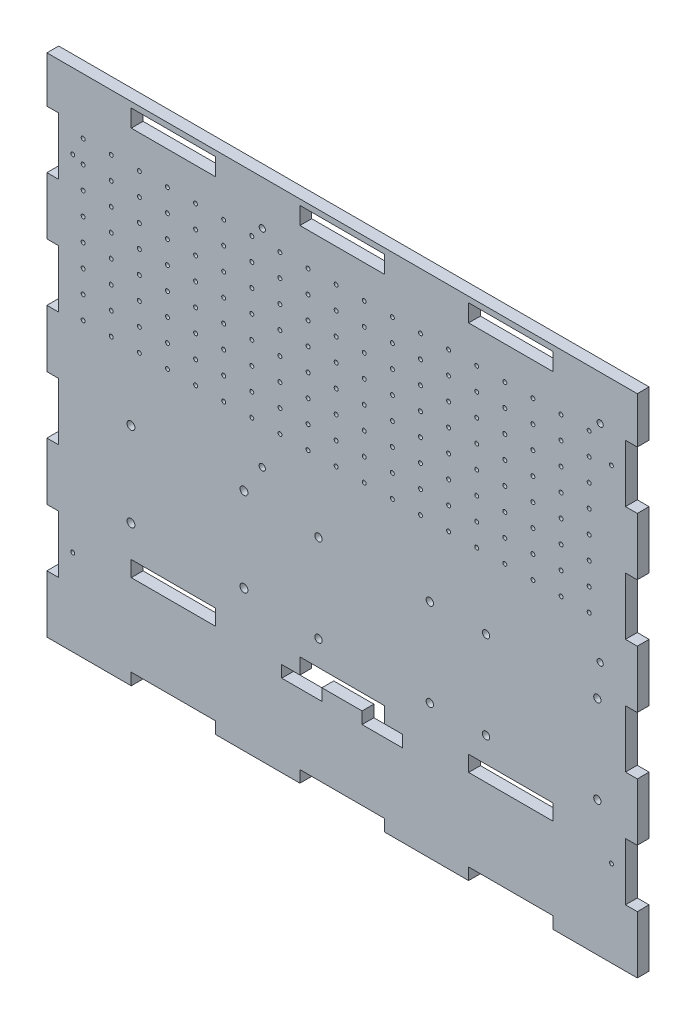
from build123d import *

# Parameters (mm, degrees)
SKETCH1_W                = 266.7
SKETCH1_H                = 223.52
BOSS_EXTRUDE1_DEPTH      = 5.334
SKETCH2_W                = 38.1
SKETCH2_H                = 5.334
CUT_EXTRUDE1_DEPTH       = 197.710659379
SKETCH5_W                = 38.1
SKETCH5_H                = 7.112
CUT_EXTRUDE3_DEPTH       = 197.710659379
SKETCH8_W                = 18.149934459
SKETCH8_H                = 5.334
SKETCH8_W_2              = 18.14993446
CUT_EXTRUDE6_DEPTH       = 197.710659379
SKETCH9_R                = 0.889
CUT_EXTRUDE7_DEPTH       = 197.710659379
SKETCH10_W               = 38.1
SKETCH10_H               = 5.334
BOSS_EXTRUDE2_DEPTH      = 10.16
BOSS_EXTRUDE3_DEPTH      = 76.2
BOSS_EXTRUDE3_DEPTH_BACK = 190.5
SKETCH12_W               = 5.334
SKETCH12_H               = 7.62
SKETCH13_W               = 38.1
SKETCH13_H               = 5.334
BOSS_EXTRUDE4_DEPTH      = 2.54
SKETCH14_W               = 38.1
SKETCH14_H               = 5.334
BOSS_EXTRUDE5_DEPTH      = 2.54
SKETCH15_W               = 38.1
SKETCH15_H               = 5.334
BOSS_EXTRUDE6_DEPTH      = 2.54
SKETCH16_W               = 5.334
SKETCH16_H               = 25.964444445
SKETCH16_H_2             = 25.964444444
CUT_EXTRUDE9_DEPTH       = 205.029793122
SKETCH17_R               = 1.651
CUT_EXTRUDE10_DEPTH      = 205.029793122
SKETCH18_R               = 0.889
CUT_EXTRUDE11_DEPTH      = 205.029793122
SKETCH19_R               = 1.778
CUT_EXTRUDE12_DEPTH      = 205.029793122
SKETCH20_W               = 266.7
SKETCH20_H               = 5.08
CUT_EXTRUDE13_DEPTH      = 205.029793122
SKETCH21_R               = 1.397
CUT_EXTRUDE14_DEPTH      = 201.339246273


with BuildPart() as part:
    # Sketch1 → Boss-Extrude1 (new body)
    with BuildSketch(Plane.XY):
        with Locations((5.474099752, 27.504142138)):
            Rectangle(SKETCH1_W, SKETCH1_H)
    extrude(amount=BOSS_EXTRUDE1_DEPTH)

    # Sketch2 → Cut-Extrude1 (cut, through all)
    with BuildSketch(Plane.XY.offset(5.334)):
        with Locations((-70.725900248, -81.588857862)):
            Rectangle(SKETCH2_W, SKETCH2_H)
        with Locations((5.474099752, -81.588857862)):
            Rectangle(SKETCH2_W, SKETCH2_H)
        with Locations((81.674099752, -81.588857862)):
            Rectangle(SKETCH2_W, SKETCH2_H)
        with Locations((81.674099752, 136.597142138)):
            Rectangle(SKETCH2_W, SKETCH2_H)
        with Locations((5.474099752, 136.597142138)):
            Rectangle(SKETCH2_W, SKETCH2_H)
        with Locations((-70.725900248, 136.597142138)):
            Rectangle(SKETCH2_W, SKETCH2_H)
    extrude(amount=-CUT_EXTRUDE1_DEPTH, mode=Mode.SUBTRACT)

    # Sketch5 → Cut-Extrude3 (cut, through all)
    with BuildSketch(Plane.XY.offset(5.334)):
        with Locations((-70.725900248, -38.378413173)):
            Rectangle(SKETCH5_W, SKETCH5_H)
        with Locations((5.474099752, -38.378413173)):
            Rectangle(SKETCH5_W, SKETCH5_H)
        with Locations((81.674099752, -38.378413173)):
            Rectangle(SKETCH5_W, SKETCH5_H)
    extrude(amount=-CUT_EXTRUDE3_DEPTH, mode=Mode.SUBTRACT)

    # Sketch8 → Cut-Extrude6 (cut, through all)
    with BuildSketch(Plane.XY.offset(5.334)):
        with Locations((-12.722736397, -44.601413173)):
            Rectangle(SKETCH8_W, SKETCH8_H)
        with Locations((23.577132522, -44.601413173)):
            Rectangle(SKETCH8_W_2, SKETCH8_H)
    extrude(amount=-CUT_EXTRUDE6_DEPTH, mode=Mode.SUBTRACT)

    # Sketch9 → Cut-Extrude7 (cut, through all)
    with BuildSketch(Plane.XY.offset(5.334)):
        with Locations((-111.514346632, 118.978930244)):
            Circle(SKETCH9_R)
        with Locations((-98.814346632, 118.978930244)):
            Circle(SKETCH9_R)
        with Locations((-86.114346632, 118.978930244)):
            Circle(SKETCH9_R)
        with Locations((-73.414346632, 118.978930244)):
            Circle(SKETCH9_R)
        with Locations((-60.714346632, 118.978930244)):
            Circle(SKETCH9_R)
        with Locations((-48.014346632, 118.978930244)):
            Circle(SKETCH9_R)
        with Locations((-35.314346632, 118.978930244)):
            Circle(SKETCH9_R)
        with Locations((-22.614346632, 118.978930244)):
            Circle(SKETCH9_R)
        with Locations((-9.914346632, 118.978930244)):
            Circle(SKETCH9_R)
        with Locations((2.785653368, 118.978930244)):
            Circle(SKETCH9_R)
        with Locations((15.485653368, 118.978930244)):
            Circle(SKETCH9_R)
        with Locations((28.185653368, 118.978930244)):
            Circle(SKETCH9_R)
        with Locations((40.885653368, 118.978930244)):
            Circle(SKETCH9_R)
        with Locations((53.585653368, 118.978930244)):
            Circle(SKETCH9_R)
        with Locations((66.285653368, 118.978930244)):
            Circle(SKETCH9_R)
        with Locations((78.985653368, 118.978930244)):
            Circle(SKETCH9_R)
        with Locations((91.685653368, 118.978930244)):
            Circle(SKETCH9_R)
        with Locations((104.385653368, 118.978930244)):
            Circle(SKETCH9_R)
        with Locations((117.085653368, 118.978930244)):
            Circle(SKETCH9_R)
        with Locations((-111.514346632, 108.818930244)):
            Circle(SKETCH9_R)
        with Locations((-98.814346632, 108.818930244)):
            Circle(SKETCH9_R)
        with Locations((-86.114346632, 108.818930244)):
            Circle(SKETCH9_R)
        with Locations((-73.414346632, 108.818930244)):
            Circle(SKETCH9_R)
        with Locations((-60.714346632, 108.818930244)):
            Circle(SKETCH9_R)
        with Locations((-48.014346632, 108.818930244)):
            Circle(SKETCH9_R)
        with Locations((-35.314346632, 108.818930244)):
            Circle(SKETCH9_R)
        with Locations((-22.614346632, 108.818930244)):
            Circle(SKETCH9_R)
        with Locations((-9.914346632, 108.818930244)):
            Circle(SKETCH9_R)
        with Locations((2.785653368, 108.818930244)):
            Circle(SKETCH9_R)
        with Locations((15.485653368, 108.818930244)):
            Circle(SKETCH9_R)
        with Locations((28.185653368, 108.818930244)):
            Circle(SKETCH9_R)
        with Locations((40.885653368, 108.818930244)):
            Circle(SKETCH9_R)
        with Locations((53.585653368, 108.818930244)):
            Circle(SKETCH9_R)
        with Locations((66.285653368, 108.818930244)):
            Circle(SKETCH9_R)
        with Locations((78.985653368, 108.818930244)):
            Circle(SKETCH9_R)
        with Locations((91.685653368, 108.818930244)):
            Circle(SKETCH9_R)
        with Locations((104.385653368, 108.818930244)):
            Circle(SKETCH9_R)
        with Locations((117.085653368, 108.818930244)):
            Circle(SKETCH9_R)
        with Locations((-111.514346632, 98.658930244)):
            Circle(SKETCH9_R)
        with Locations((-98.814346632, 98.658930244)):
            Circle(SKETCH9_R)
        with Locations((-86.114346632, 98.658930244)):
            Circle(SKETCH9_R)
        with Locations((-73.414346632, 98.658930244)):
            Circle(SKETCH9_R)
        with Locations((-60.714346632, 98.658930244)):
            Circle(SKETCH9_R)
        with Locations((-48.014346632, 98.658930244)):
            Circle(SKETCH9_R)
        with Locations((-35.314346632, 98.658930244)):
            Circle(SKETCH9_R)
        with Locations((-22.614346632, 98.658930244)):
            Circle(SKETCH9_R)
        with Locations((-9.914346632, 98.658930244)):
            Circle(SKETCH9_R)
        with Locations((2.785653368, 98.658930244)):
            Circle(SKETCH9_R)
        with Locations((15.485653368, 98.658930244)):
            Circle(SKETCH9_R)
        with Locations((28.185653368, 98.658930244)):
            Circle(SKETCH9_R)
        with Locations((40.885653368, 98.658930244)):
            Circle(SKETCH9_R)
        with Locations((53.585653368, 98.658930244)):
            Circle(SKETCH9_R)
        with Locations((66.285653368, 98.658930244)):
            Circle(SKETCH9_R)
        with Locations((78.985653368, 98.658930244)):
            Circle(SKETCH9_R)
        with Locations((91.685653368, 98.658930244)):
            Circle(SKETCH9_R)
        with Locations((104.385653368, 98.658930244)):
            Circle(SKETCH9_R)
        with Locations((117.085653368, 98.658930244)):
            Circle(SKETCH9_R)
        with Locations((-111.514346632, 88.498930244)):
            Circle(SKETCH9_R)
        with Locations((-98.814346632, 88.498930244)):
            Circle(SKETCH9_R)
        with Locations((-86.114346632, 88.498930244)):
            Circle(SKETCH9_R)
        with Locations((-73.414346632, 88.498930244)):
            Circle(SKETCH9_R)
        with Locations((-60.714346632, 88.498930244)):
            Circle(SKETCH9_R)
        with Locations((-48.014346632, 88.498930244)):
            Circle(SKETCH9_R)
        with Locations((-35.314346632, 88.498930244)):
            Circle(SKETCH9_R)
        with Locations((-22.614346632, 88.498930244)):
            Circle(SKETCH9_R)
        with Locations((-9.914346632, 88.498930244)):
            Circle(SKETCH9_R)
        with Locations((2.785653368, 88.498930244)):
            Circle(SKETCH9_R)
        with Locations((15.485653368, 88.498930244)):
            Circle(SKETCH9_R)
        with Locations((28.185653368, 88.498930244)):
            Circle(SKETCH9_R)
        with Locations((40.885653368, 88.498930244)):
            Circle(SKETCH9_R)
        with Locations((53.585653368, 88.498930244)):
            Circle(SKETCH9_R)
        with Locations((66.285653368, 88.498930244)):
            Circle(SKETCH9_R)
        with Locations((78.985653368, 88.498930244)):
            Circle(SKETCH9_R)
        with Locations((91.685653368, 88.498930244)):
            Circle(SKETCH9_R)
        with Locations((104.385653368, 88.498930244)):
            Circle(SKETCH9_R)
        with Locations((117.085653368, 88.498930244)):
            Circle(SKETCH9_R)
        with Locations((-111.514346632, 78.338930244)):
            Circle(SKETCH9_R)
        with Locations((-98.814346632, 78.338930244)):
            Circle(SKETCH9_R)
        with Locations((-86.114346632, 78.338930244)):
            Circle(SKETCH9_R)
        with Locations((-73.414346632, 78.338930244)):
            Circle(SKETCH9_R)
        with Locations((-60.714346632, 78.338930244)):
            Circle(SKETCH9_R)
        with Locations((-48.014346632, 78.338930244)):
            Circle(SKETCH9_R)
        with Locations((-35.314346632, 78.338930244)):
            Circle(SKETCH9_R)
        with Locations((-22.614346632, 78.338930244)):
            Circle(SKETCH9_R)
        with Locations((-9.914346632, 78.338930244)):
            Circle(SKETCH9_R)
        with Locations((2.785653368, 78.338930244)):
            Circle(SKETCH9_R)
        with Locations((15.485653368, 78.338930244)):
            Circle(SKETCH9_R)
        with Locations((28.185653368, 78.338930244)):
            Circle(SKETCH9_R)
        with Locations((40.885653368, 78.338930244)):
            Circle(SKETCH9_R)
        with Locations((53.585653368, 78.338930244)):
            Circle(SKETCH9_R)
        with Locations((66.285653368, 78.338930244)):
            Circle(SKETCH9_R)
        with Locations((78.985653368, 78.338930244)):
            Circle(SKETCH9_R)
        with Locations((91.685653368, 78.338930244)):
            Circle(SKETCH9_R)
        with Locations((104.385653368, 78.338930244)):
            Circle(SKETCH9_R)
        with Locations((117.085653368, 78.338930244)):
            Circle(SKETCH9_R)
        with Locations((-111.514346632, 68.178930244)):
            Circle(SKETCH9_R)
        with Locations((-98.814346632, 68.178930244)):
            Circle(SKETCH9_R)
        with Locations((-86.114346632, 68.178930244)):
            Circle(SKETCH9_R)
        with Locations((-73.414346632, 68.178930244)):
            Circle(SKETCH9_R)
        with Locations((-60.714346632, 68.178930244)):
            Circle(SKETCH9_R)
        with Locations((-48.014346632, 68.178930244)):
            Circle(SKETCH9_R)
        with Locations((-35.314346632, 68.178930244)):
            Circle(SKETCH9_R)
        with Locations((-22.614346632, 68.178930244)):
            Circle(SKETCH9_R)
        with Locations((-9.914346632, 68.178930244)):
            Circle(SKETCH9_R)
        with Locations((2.785653368, 68.178930244)):
            Circle(SKETCH9_R)
        with Locations((15.485653368, 68.178930244)):
            Circle(SKETCH9_R)
        with Locations((28.185653368, 68.178930244)):
            Circle(SKETCH9_R)
        with Locations((40.885653368, 68.178930244)):
            Circle(SKETCH9_R)
        with Locations((53.585653368, 68.178930244)):
            Circle(SKETCH9_R)
        with Locations((66.285653368, 68.178930244)):
            Circle(SKETCH9_R)
        with Locations((78.985653368, 68.178930244)):
            Circle(SKETCH9_R)
        with Locations((91.685653368, 68.178930244)):
            Circle(SKETCH9_R)
        with Locations((104.385653368, 68.178930244)):
            Circle(SKETCH9_R)
        with Locations((117.085653368, 68.178930244)):
            Circle(SKETCH9_R)
        with Locations((-111.514346632, 58.018930244)):
            Circle(SKETCH9_R)
        with Locations((-98.814346632, 58.018930244)):
            Circle(SKETCH9_R)
        with Locations((-86.114346632, 58.018930244)):
            Circle(SKETCH9_R)
        with Locations((-73.414346632, 58.018930244)):
            Circle(SKETCH9_R)
        with Locations((-60.714346632, 58.018930244)):
            Circle(SKETCH9_R)
        with Locations((-48.014346632, 58.018930244)):
            Circle(SKETCH9_R)
        with Locations((-35.314346632, 58.018930244)):
            Circle(SKETCH9_R)
        with Locations((-22.614346632, 58.018930244)):
            Circle(SKETCH9_R)
        with Locations((-9.914346632, 58.018930244)):
            Circle(SKETCH9_R)
        with Locations((2.785653368, 58.018930244)):
            Circle(SKETCH9_R)
        with Locations((15.485653368, 58.018930244)):
            Circle(SKETCH9_R)
        with Locations((28.185653368, 58.018930244)):
            Circle(SKETCH9_R)
        with Locations((40.885653368, 58.018930244)):
            Circle(SKETCH9_R)
        with Locations((53.585653368, 58.018930244)):
            Circle(SKETCH9_R)
        with Locations((66.285653368, 58.018930244)):
            Circle(SKETCH9_R)
        with Locations((78.985653368, 58.018930244)):
            Circle(SKETCH9_R)
        with Locations((91.685653368, 58.018930244)):
            Circle(SKETCH9_R)
        with Locations((104.385653368, 58.018930244)):
            Circle(SKETCH9_R)
        with Locations((117.085653368, 58.018930244)):
            Circle(SKETCH9_R)
        with Locations((-111.514346632, 47.858930244)):
            Circle(SKETCH9_R)
        with Locations((-98.814346632, 47.858930244)):
            Circle(SKETCH9_R)
        with Locations((-86.114346632, 47.858930244)):
            Circle(SKETCH9_R)
        with Locations((-73.414346632, 47.858930244)):
            Circle(SKETCH9_R)
        with Locations((-60.714346632, 47.858930244)):
            Circle(SKETCH9_R)
        with Locations((-48.014346632, 47.858930244)):
            Circle(SKETCH9_R)
        with Locations((-35.314346632, 47.858930244)):
            Circle(SKETCH9_R)
        with Locations((-22.614346632, 47.858930244)):
            Circle(SKETCH9_R)
        with Locations((-9.914346632, 47.858930244)):
            Circle(SKETCH9_R)
        with Locations((2.785653368, 47.858930244)):
            Circle(SKETCH9_R)
        with Locations((15.485653368, 47.858930244)):
            Circle(SKETCH9_R)
        with Locations((28.185653368, 47.858930244)):
            Circle(SKETCH9_R)
        with Locations((40.885653368, 47.858930244)):
            Circle(SKETCH9_R)
        with Locations((53.585653368, 47.858930244)):
            Circle(SKETCH9_R)
        with Locations((66.285653368, 47.858930244)):
            Circle(SKETCH9_R)
        with Locations((78.985653368, 47.858930244)):
            Circle(SKETCH9_R)
        with Locations((91.685653368, 47.858930244)):
            Circle(SKETCH9_R)
        with Locations((104.385653368, 47.858930244)):
            Circle(SKETCH9_R)
        with Locations((117.085653368, 47.858930244)):
            Circle(SKETCH9_R)
    extrude(amount=-CUT_EXTRUDE7_DEPTH, mode=Mode.SUBTRACT)

    # Sketch10 → Boss-Extrude2 (add)
    with BuildSketch(Plane(origin=(0, 139.264142138, 0), x_dir=(1, 0, 0), z_dir=(0, 1, 0))):
        with Locations((-32.625900248, -2.667)):
            Rectangle(SKETCH10_W, SKETCH10_H)
    extrude(amount=BOSS_EXTRUDE2_DEPTH)

    # Sketch12 → Boss-Extrude3 (add, two sides: drawn at the far end of the back side and taken through both)
    with BuildSketch(Plane.ZY.offset(51.675900248).offset(-BOSS_EXTRUDE3_DEPTH_BACK)):
        with Locations((2.667, 145.614142138)):
            Rectangle(SKETCH12_W, SKETCH12_H)
    extrude(amount=BOSS_EXTRUDE3_DEPTH + BOSS_EXTRUDE3_DEPTH_BACK)

    # Sketch13 → Boss-Extrude4 (add)
    with BuildSketch(Plane(origin=(0, 139.264142138, 0), x_dir=(1, 0, 0), z_dir=(0, 1, 0))):
        with Locations((-108.825900248, -2.667)):
            Rectangle(SKETCH13_W, SKETCH13_H)
    extrude(amount=BOSS_EXTRUDE4_DEPTH)

    # Sketch14 → Boss-Extrude5 (add)
    with BuildSketch(Plane(origin=(0, 139.264142138, 0), x_dir=(1, 0, 0), z_dir=(0, 1, 0))):
        with Locations((43.574099752, -2.667)):
            Rectangle(SKETCH14_W, SKETCH14_H)
    extrude(amount=BOSS_EXTRUDE5_DEPTH)

    # Sketch15 → Boss-Extrude6 (add)
    with BuildSketch(Plane(origin=(0, 139.264142138, 0), x_dir=(1, 0, 0), z_dir=(0, 1, 0))):
        with Locations((119.774099752, -2.667)):
            Rectangle(SKETCH15_W, SKETCH15_H)
    extrude(amount=BOSS_EXTRUDE6_DEPTH)

    # Sketch16 → Cut-Extrude9 (cut, through all)
    with BuildSketch(Plane.XY.offset(5.334)):
        with Locations((-125.208900248, -45.309191196)):
            Rectangle(SKETCH16_W, SKETCH16_H)
        with Locations((-125.208900248, 6.619697693)):
            Rectangle(SKETCH16_W, SKETCH16_H)
        with Locations((-125.208900248, 58.548586582)):
            Rectangle(SKETCH16_W, SKETCH16_H_2)
        with Locations((-125.208900248, 110.477475471)):
            Rectangle(SKETCH16_W, SKETCH16_H_2)
        with Locations((136.157099752, 110.477475471)):
            Rectangle(SKETCH16_W, SKETCH16_H_2)
        with Locations((136.157099752, 58.548586582)):
            Rectangle(SKETCH16_W, SKETCH16_H_2)
        with Locations((136.157099752, 6.619697693)):
            Rectangle(SKETCH16_W, SKETCH16_H)
        with Locations((136.157099752, -45.309191196)):
            Rectangle(SKETCH16_W, SKETCH16_H)
    extrude(amount=-CUT_EXTRUDE9_DEPTH, mode=Mode.SUBTRACT)

    # Sketch17 → Cut-Extrude10 (cut, through all)
    with BuildSketch(Plane.XY.offset(5.334)):
        with Locations((120.790099752, 16.108930244)):
            Circle(SKETCH17_R)
        with Locations((70.498099752, 16.108930244)):
            Circle(SKETCH17_R)
        with Locations((70.498099752, -23.515069756)):
            Circle(SKETCH17_R)
        with Locations((120.790099752, -23.515069756)):
            Circle(SKETCH17_R)
        with Locations((45.098099752, 16.108930244)):
            Circle(SKETCH17_R)
        with Locations((-5.193900248, 16.108930244)):
            Circle(SKETCH17_R)
        with Locations((-5.193900248, -23.515069756)):
            Circle(SKETCH17_R)
        with Locations((45.098099752, -23.515069756)):
            Circle(SKETCH17_R)
    extrude(amount=-CUT_EXTRUDE10_DEPTH, mode=Mode.SUBTRACT)

    # Sketch18 → Cut-Extrude11 (cut, through all)
    with BuildSketch(Plane.XY.offset(5.334)):
        with Locations((127.140099752, 110.477475471)):
            Circle(SKETCH18_R)
        with Locations((-116.191900248, 110.477475471)):
            Circle(SKETCH18_R)
        with Locations((-116.191900248, -45.309191196)):
            Circle(SKETCH18_R)
        with Locations((127.140099752, -45.309191196)):
            Circle(SKETCH18_R)
    extrude(amount=-CUT_EXTRUDE11_DEPTH, mode=Mode.SUBTRACT)

    # Sketch19 → Cut-Extrude12 (cut, through all)
    with BuildSketch(Plane(origin=(0, 0, 0), x_dir=(-1, 0, 0), z_dir=(0, 0, -1))):
        with Locations((89.902900248, 17.505930244)):
            Circle(SKETCH19_R)
        with Locations((89.902900248, -20.594069756)):
            Circle(SKETCH19_R)
        with Locations((38.848900248, -20.594069756)):
            Circle(SKETCH19_R)
        with Locations((38.848900248, 17.505930244)):
            Circle(SKETCH19_R)
    extrude(amount=-CUT_EXTRUDE12_DEPTH, mode=Mode.SUBTRACT)

    # Sketch20 → Cut-Extrude13 (cut, through all)
    with BuildSketch(Plane.XY.offset(5.334)):
        with Locations((5.474099752, 146.884142138)):
            Rectangle(SKETCH20_W, SKETCH20_H)
    extrude(amount=-CUT_EXTRUDE13_DEPTH, mode=Mode.SUBTRACT)

    # Sketch21 → Cut-Extrude14 (cut, through all)
    with BuildSketch(Plane(origin=(0, 0, 0), x_dir=(-1, 0, 0), z_dir=(0, 0, -1))):
        with Locations((-122.060099752, 30.840930244)):
            Circle(SKETCH21_R)
        with Locations((-122.060099752, 124.312930244)):
            Circle(SKETCH21_R)
        with Locations((30.593900248, 30.840930244)):
            Circle(SKETCH21_R)
        with Locations((30.593900248, 124.312930244)):
            Circle(SKETCH21_R)
    extrude(amount=-CUT_EXTRUDE14_DEPTH, mode=Mode.SUBTRACT)


solid = part.part
